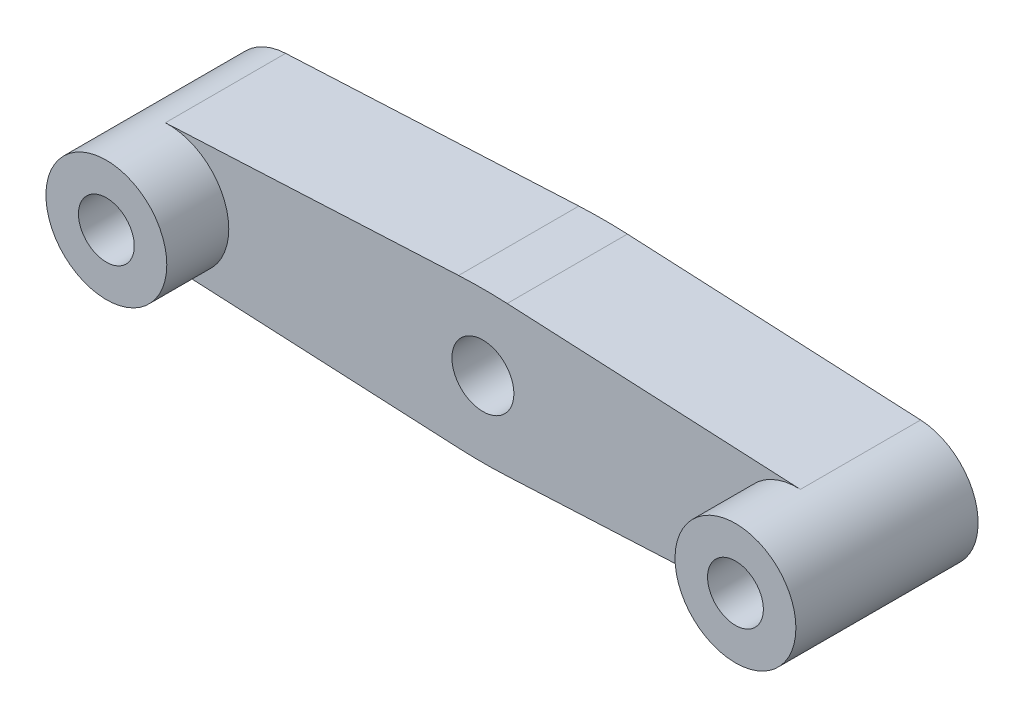
from build123d import *

# Parameters (mm, degrees)
SKETCH_1_R                   = 9.75
EXTRUDE_1_DEPTH              = 19.4
SKETCH_1_3_R                 = 9.75
EXTRUDE_2_DEPTH              = 29.4
SKETCH_2_R                   = 5
CUT_EXTRUDE_1_DEPTH          = 69.371576697
FILLET_1_R                   = 80
HOLE_WIZARD_M8_1_D           = 9
HOLE_WIZARD_M8_1_CBORE_D     = 15
HOLE_WIZARD_M8_1_CBORE_DEPTH = 8


with BuildPart() as part:
    # 스케치1 → 보스-돌출1 (new body)
    with BuildSketch(Plane.XY):
        with Locations((-50.75, 0)):
            Circle(SKETCH_1_R)
        with BuildLine():
            Line((-51.227471847, -9.738301733), (0, -12.25))
            Line((0, -12.25), (0, 12.25))
            Line((0, 12.25), (-51.227471847, 9.738301733))
            ThreePointArc((-51.227471847, 9.738301733), (-44.026639624, 7.061085274), (-41, 0))
            ThreePointArc((-41, 0), (-44.026639624, -7.061085274), (-51.227471847, -9.738301733))
        make_face()
        with BuildLine():
            Line((0, 12.25), (0, -12.25))
            Line((0, -12.25), (51.227471847, -9.738301733))
            ThreePointArc((51.227471847, -9.738301733), (41, 0), (51.227471847, 9.738301733))
            Line((51.227471847, 9.738301733), (0, 12.25))
        make_face()
        with Locations((50.75, 0)):
            Circle(SKETCH_1_R)
    extrude(amount=EXTRUDE_1_DEPTH)

    # 스케치1<3> → 보스-돌출2 (add)
    with BuildSketch(Plane.XY):
        with Locations(Location((-50.75, 0, 0), (0, 0, 92.806981348))):
            Circle(SKETCH_1_3_R)
        with Locations(Location((50.75, 0, 0), (0, 0, 87.193018652))):
            Circle(SKETCH_1_3_R)
    extrude(amount=EXTRUDE_2_DEPTH)

    # 스케치2 → 컷-돌출1 (cut, through all)
    with BuildSketch(Plane.XY):
        Circle(SKETCH_2_R)
    extrude(amount=CUT_EXTRUDE_1_DEPTH, mode=Mode.SUBTRACT)

    # 필렛1
    # the kernel refuses this fillet: 80 mm, written as the material it takes off along each edge
    with BuildSketch(Plane(origin=(0, 12.25, -9.806059822), x_dir=(0.9988001777044758, -0.048971471465613654, 0), z_dir=(0, 0, 1))) as fillet_1_piece_1:
        with BuildLine():
            CenterArc((FILLET_1_R * 0.0490302991116, -FILLET_1_R), FILLET_1_R, 90, 5.613962695)
            Line((-FILLET_1_R * 0.048795129693, -FILLET_1_R * 0.00479641003501), (0, 0))
            Line((0, 0), (FILLET_1_R * 0.0490302991116, 0))
        make_face()
    extrude(amount=39.012119645, mode=Mode.SUBTRACT)
    with BuildSketch(Plane(origin=(0, -12.25, -9.806059822), x_dir=(0.9988001777044758, 0.0489714714656137, 0), z_dir=(0, 0, 1))) as fillet_1_piece_2:
        with BuildLine():
            CenterArc((FILLET_1_R * 0.0490302991116, FILLET_1_R), FILLET_1_R, 264.386037305, 5.613962695)
            Line((-FILLET_1_R * 0.048795129693, FILLET_1_R * 0.00479641003501), (0, 0))
            Line((0, 0), (FILLET_1_R * 0.0490302991116, 0))
        make_face()
    extrude(amount=39.012119645, mode=Mode.SUBTRACT)

    # M8 소켓 머리 캡 나사용 카운터보어1 (through all)
    with Locations(Plane(origin=(0, 0, 0), x_dir=(-1, 0, 0), z_dir=(0, 0, -1))):
        with Locations((-50.75, 0), (50.75, 0)):
            CounterBoreHole(HOLE_WIZARD_M8_1_D / 2, HOLE_WIZARD_M8_1_CBORE_D / 2, HOLE_WIZARD_M8_1_CBORE_DEPTH)


solid = part.part
